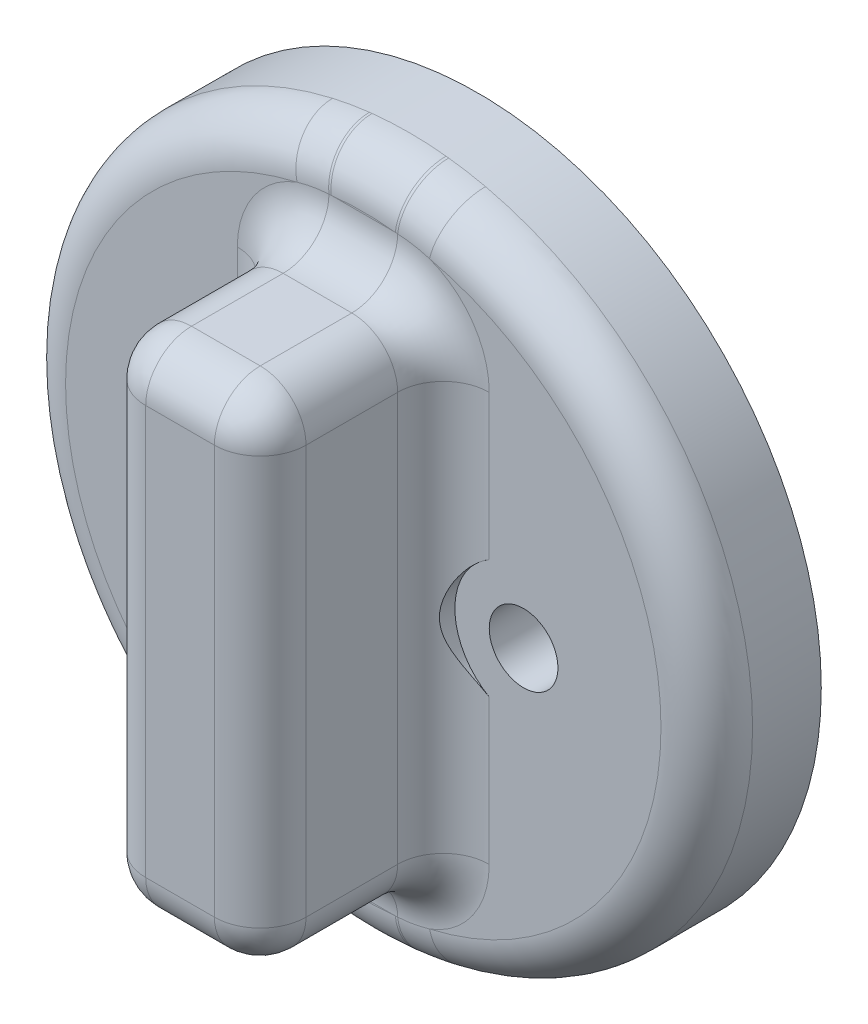
from build123d import *

# Parameters (mm, degrees)
SKETCH2_R           = 15
BOSS_EXTRUDE2_DEPTH = 5
SKETCH3_W           = 7
SKETCH3_H           = 21.84901374
BOSS_EXTRUDE4_DEPTH = 8
FILLET1_R           = 2
FILLET2_R           = 2
SKETCH4_R           = 1.5
M4_DRILL_DEPTH      = 5
SKETCH5_R           = 3
CUT_EXTRUDE1_DEPTH  = 8


with BuildPart() as part:
    # Sketch2 → Boss-Extrude2 (new body)
    with BuildSketch(Plane.XY):
        Circle(SKETCH2_R)
    extrude(amount=BOSS_EXTRUDE2_DEPTH)

    # Sketch3 → Boss-Extrude4 (add)
    with BuildSketch(Plane.XY.offset(5)):
        Rectangle(SKETCH3_W, SKETCH3_H)
    extrude(amount=BOSS_EXTRUDE4_DEPTH)

    # Fillet1
    fillet1_edges = [part.edges().sort_by_distance(p)[0] for p in [
        (3.5, 0, 5),
        (3.5, -10.92450687, 9),
        (0, 10.92450687, 5),
        (3.5, 10.92450687, 9),
        (-3.5, 0, 5),
        (-3.5, 10.92450687, 9),
        (0, -10.92450687, 5),
        (-3.5, -10.92450687, 9),
        (3.5, 0, 13),
        (0, 10.92450687, 13),
        (-3.5, 0, 13),
        (0, -10.92450687, 13),
    ]]
    fillet(fillet1_edges, radius=FILLET1_R)

    # Fillet2
    # the kernel refuses this fillet: 2 mm, written as the material it takes off along each edge
    with BuildSketch(Plane(origin=(0, 0, 5), x_dir=(1, 0, 0), z_dir=(0, -1, 0))) as fillet2_piece_1:
        with BuildLine():
            CenterArc((15 - FILLET2_R, -FILLET2_R), FILLET2_R, 0, 90)
            Line((15, -FILLET2_R), (15 + FILLET2_R * 0.02, -FILLET2_R))
            Line((15 + FILLET2_R * 0.02, -FILLET2_R), (15 + FILLET2_R * 0.02, FILLET2_R * 0.02))
            Line((15 + FILLET2_R * 0.02, FILLET2_R * 0.02), (15 - FILLET2_R, FILLET2_R * 0.02))
            Line((15 - FILLET2_R, FILLET2_R * 0.02), (15 - FILLET2_R, 0))
        make_face()
    revolve(axis=Axis((0, 0, 5), (0, 0, 1)), mode=Mode.SUBTRACT)

    # Sketch4 → M4_DRILL (cut)
    with BuildSketch(Plane.XY):
        with Locations((-7, 0)):
            Circle(SKETCH4_R)
        with Locations(Location((7, 0, 0), (0, 0, 180))):
            Circle(SKETCH4_R)
    extrude(amount=M4_DRILL_DEPTH, mode=Mode.SUBTRACT)

    # Sketch5 → Cut-Extrude1 (cut)
    with BuildSketch(Plane.XY.offset(5)):
        with Locations((-7, 0)):
            Circle(SKETCH5_R)
        with Locations((7, 0)):
            Circle(SKETCH5_R)
    extrude(amount=CUT_EXTRUDE1_DEPTH, mode=Mode.SUBTRACT)


solid = part.part
